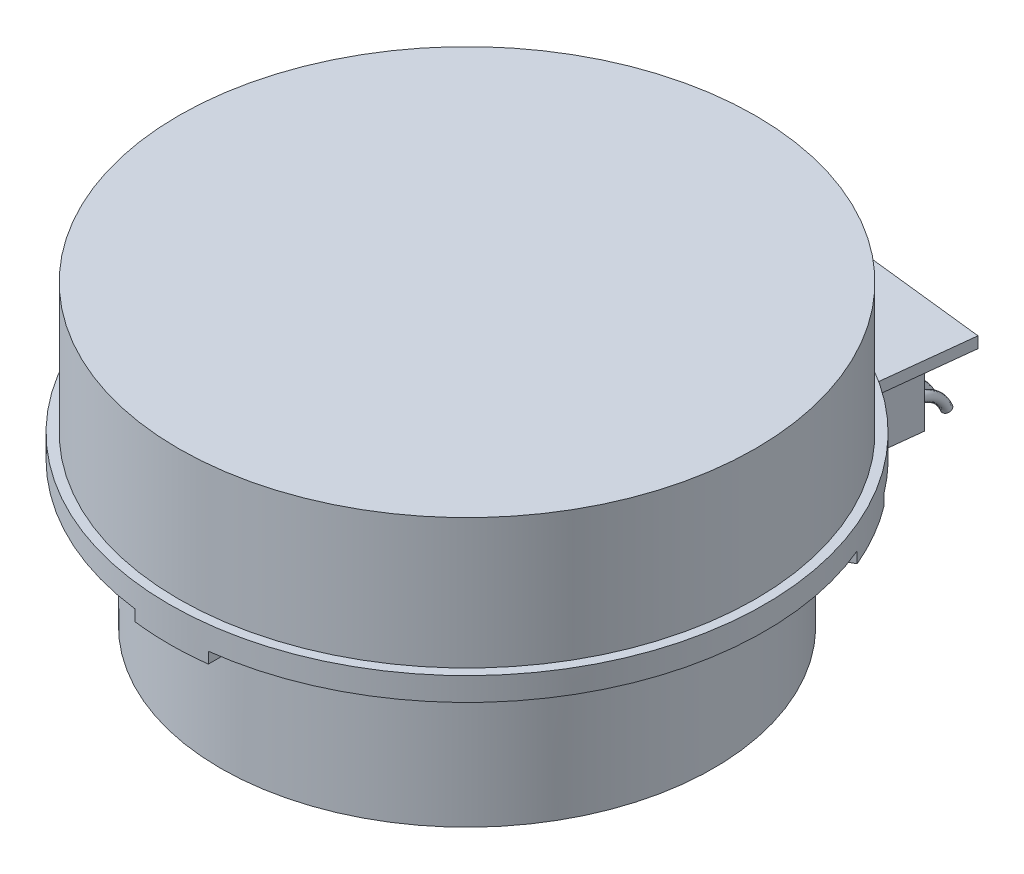
from build123d import *
from build123d.topology import SkipClean

# Parameters (mm, degrees)
BOSS_EXTRU_1_START = 1.2
ESQUISSE3_R        = 1
BOSS_EXTRU_1_DEPTH = 1.2
ESQUISSE4_R        = 0.9
BOSS_EXTRU_2_DEPTH = 2.3
BOSS_EXTRU_3_DEPTH = 9
ESQUISSE6_R        = 0.5
BOSS_EXTRU_4_START = 5.5
BOSS_EXTRU_4_DEPTH = 5.5
ESQUISSE9_R        = 1.5
BOSS_EXTRU_5_DEPTH = 1.5
CONG_1_R           = 1.5


with BuildPart() as part:
    # Esquisse2 → Révolution2 (revolve)
    with BuildSketch(Plane.XY, mode=Mode.PRIVATE) as r_volution2_sk:
        Polygon((0, 0), (31, 0), (31, -14), (32, -14), (32, -16.5), (26.5, -16.5), (26.5, -32), (16, -32), (16, -36.5), (0, -36.5), align=None)
    revolve(r_volution2_sk.sketch.rotate(Axis((0, 27.033991121, 0), (0, -1, 0)), 90), axis=Axis((0, 27.033991121, 0), (0, -1, 0)))

    # Esquisse3 → Boss.-Extru.1 (add)
    # profile 1 of 5: a face of its own
    with SkipClean():  # the faces are left unmerged after this step: merging them gives an invalid solid
        with BuildSketch(Plane.XZ.offset(16.5).offset(BOSS_EXTRU_1_START)):
            with BuildLine():
                Line((-3.95, 26.203959624), (-3.95, 31.755275152))
                ThreePointArc((-3.95, 31.755275152), (0, 32), (3.95, 31.755275152))
                Line((3.95, 31.755275152), (3.95, 26.203959624))
                ThreePointArc((3.95, 26.203959624), (0, 26.5), (-3.95, 26.203959624))
            make_face()
            with Locations(Location((0, 28.9, 0), (0, 0, 270))):
                Circle(ESQUISSE3_R, mode=Mode.SUBTRACT)
        # profile 2 of 5: a face of its own
        with BuildSketch(Plane.XZ.offset(16.5).offset(BOSS_EXTRU_1_START)):
            with BuildLine():
                Line((24.668294715, -9.681179467), (29.475874986, -12.456837231))
                ThreePointArc((29.475874986, -12.456837231), (27.712812921, -16), (25.525874986, -19.298437921))
                Line((25.525874986, -19.298437921), (20.718294715, -16.522780157))
                ThreePointArc((20.718294715, -16.522780157), (22.9496732, -13.25), (24.668294715, -9.681179467))
            make_face()
            with Locations(Location((25.028134169, -14.45, 0), (0, 0, 270))):
                Circle(ESQUISSE3_R, mode=Mode.SUBTRACT)
        # profile 3 of 5: a face of its own
        with BuildSketch(Plane.XZ.offset(16.5).offset(BOSS_EXTRU_1_START)):
            with BuildLine():
                Line((-20.718294715, -16.522780157), (-25.525874986, -19.298437921))
                ThreePointArc((-25.525874986, -19.298437921), (-27.712812921, -16), (-29.475874986, -12.456837231))
                Line((-29.475874986, -12.456837231), (-24.668294715, -9.681179467))
                ThreePointArc((-24.668294715, -9.681179467), (-22.9496732, -13.25), (-20.718294715, -16.522780157))
            make_face()
            with Locations(Location((-25.028134169, -14.45, 0), (0, 0, 270))):
                Circle(ESQUISSE3_R, mode=Mode.SUBTRACT)
        # profile 4 of 5: a face of its own
        with BuildSketch(Plane.XZ.offset(16.5).offset(BOSS_EXTRU_1_START)):
            with BuildLine():
                Line((-8.762023483, -25.009537071), (-6.90549745, -41.530881341))
                Line((-6.90549745, -41.530881341), (15.950649261, -38.962504901))
                Line((15.950649261, -38.962504901), (14.094123228, -22.441160631))
                ThreePointArc((14.094123228, -22.441160631), (2.959216333, -26.334255993), (-8.762023483, -25.009537071))
            make_face()
        # profile 5 of 5: a face of its own
        with BuildSketch(Plane.XZ.offset(16.5).offset(BOSS_EXTRU_1_START)):
            with BuildLine():
                Line((-26.19377674, 4.016971505), (-37.161972345, 3.603860631))
                Line((-37.161972345, 3.603860631), (-36.785594881, -6.389053859))
                Line((-36.785594881, -6.389053859), (-25.817399277, -5.975942985))
                ThreePointArc((-25.817399277, -5.975942985), (-26.481223399, -0.997400278), (-26.19377674, 4.016971505))
            make_face()
        extrude(amount=-BOSS_EXTRU_1_DEPTH)

    # Esquisse4 → Boss.-Extru.2 (add)
    with SkipClean():  # the faces are left unmerged after this step: merging them gives an invalid solid
        with BuildSketch(Plane.XZ.offset(16.5)):
            with Locations(Location((-25.164175375, 14.414030585, 0), (0, 0, 90))):
                Circle(ESQUISSE4_R)
        extrude(amount=BOSS_EXTRU_2_DEPTH)

    # Esquisse5 → Boss.-Extru.3 (add)
    with SkipClean():  # the faces are left unmerged after this step: merging them gives an invalid solid
        with BuildSketch(Plane.XZ.offset(17.7)):
            Polygon((-6.135089023, -39.431721782), (11.752330142, -37.421688046), (11.193987438, -32.4529605), (-6.693431727, -34.462994236), align=None)
        extrude(amount=BOSS_EXTRU_3_DEPTH)

    # Balayage1: sweep along a path in Esquisse7
    with SkipClean():  # the faces are left unmerged after this step: merging them gives an invalid solid
        with BuildLine() as balayage1_path:  # in the path sketch's own coordinates; laid on its plane below (add() does not lay a ready-made edge on the line's plane)
            add(Edge.make_bspline(
                [(38.5, -24.95), (41.367853236, -25.087515147), (42.236161392, -27.313918088)],
                knots=[0, 0, 0, 1, 1, 1], degree=2))
        # Esquisse6 → Balayage1 (sweep)
        with BuildSketch(Plane(origin=(4.299238823, 0, -38.259202103), x_dir=(-0.9937455091623476, 0, -0.11166854086835162), z_dir=(0.11166854086835162, 0, -0.9937455091623476))):
            with Locations((8.5, -24.95)):
                Circle(ESQUISSE6_R)
            with Locations((6.5, -24.95)):
                Circle(ESQUISSE6_R)
            with Locations((4.5, -24.95)):
                Circle(ESQUISSE6_R)
            with Locations((2.5, -24.95)):
                Circle(ESQUISSE6_R)
            with Locations((0.5, -24.95)):
                Circle(ESQUISSE6_R)
            with Locations((-1.5, -24.95)):
                Circle(ESQUISSE6_R)
            with Locations((-3.5, -24.95)):
                Circle(ESQUISSE6_R)
            with Locations((-5.5, -24.95)):
                Circle(ESQUISSE6_R)
        sweep(path=Plane(origin=(7.453091319, 0, 0.837514057), x_dir=(0.11166854086835176, 0, -0.9937455091623475), z_dir=(0.9937455091623475, 0, 0.11166854086835176)) * balayage1_path.line)

    # Esquisse8 → Boss.-Extru.4 (add)
    with SkipClean():  # the faces are left unmerged after this step: merging them gives an invalid solid
        with BuildSketch(Plane.XZ.offset(17.7).offset(BOSS_EXTRU_4_START)):
            with BuildLine():
                Line((-8.591950528, -28.7617956), (6.901464389, -29.213563447))
                Line((6.901464389, -29.213563447), (7.008098545, -25.55653644))
                ThreePointArc((7.008098545, -25.55653644), (-0.772377288, -26.488741633), (-8.485316373, -25.104768592))
                Line((-8.485316373, -25.104768592), (-8.591950528, -28.7617956))
            make_face()
        extrude(amount=-BOSS_EXTRU_4_DEPTH)

    # Esquisse9 → Boss.-Extru.5 (add)
    with SkipClean():  # the faces are left unmerged after this step: merging them gives an invalid solid
        with BuildSketch(Plane.XZ.offset(17.7)):
            with Locations(Location((9.159300523, -27.778761478, 0), (0, 0, 270))):
                Circle(ESQUISSE9_R)
        extrude(amount=BOSS_EXTRU_5_DEPTH)

    # Congé1
    cong_1_edges = [part.edges().sort_by_distance(p)[0] for p in [
        (9.159300523, -19.2, -26.278761478),
    ]]
    fillet(cong_1_edges, radius=CONG_1_R - 0.0001)  # a hair under: the kernel refuses the full size


solid = part.part
